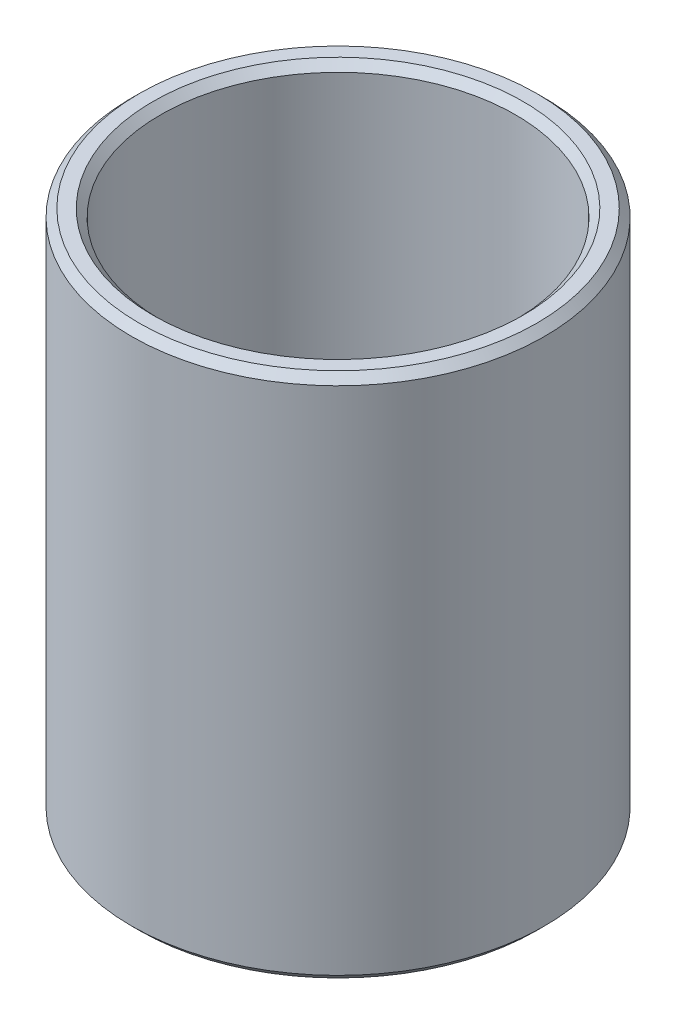
from build123d import *

# Parameters (mm, degrees)
SKETCH1_R           = 30
BOSS_EXTRUDE1_DEPTH = 76.39980269
SKETCH2_R           = 25.78363739
CUT_EXTRUDE1_DEPTH  = 88.389529413
CHAMFER1_SIZE       = 1.111730828


with BuildPart() as part:
    # Sketch1 → Boss-Extrude1 (new body)
    with BuildSketch(Plane(origin=(0, 0, 0), x_dir=(1, 0, 0), z_dir=(0, 1, 0))):
        Circle(SKETCH1_R)
    extrude(amount=BOSS_EXTRUDE1_DEPTH)

    # Sketch2 → Cut-Extrude1 (cut, through all)
    with BuildSketch(Plane(origin=(0, 0, 0), x_dir=(1, 0, 0), z_dir=(0, 1, 0))):
        Circle(SKETCH2_R)
    extrude(amount=CUT_EXTRUDE1_DEPTH, mode=Mode.SUBTRACT)

    # Chamfer1
    chamfer1_edges = [part.edges().sort_by_distance(p)[0] for p in [
        (-25.78363739, 76.39980269, 0),
        (-25.78363739, 0, 0),
        (-30, 0, 0),
        (-30, 76.39980269, 0),
    ]]
    chamfer(chamfer1_edges, length=CHAMFER1_SIZE)


solid = part.part
